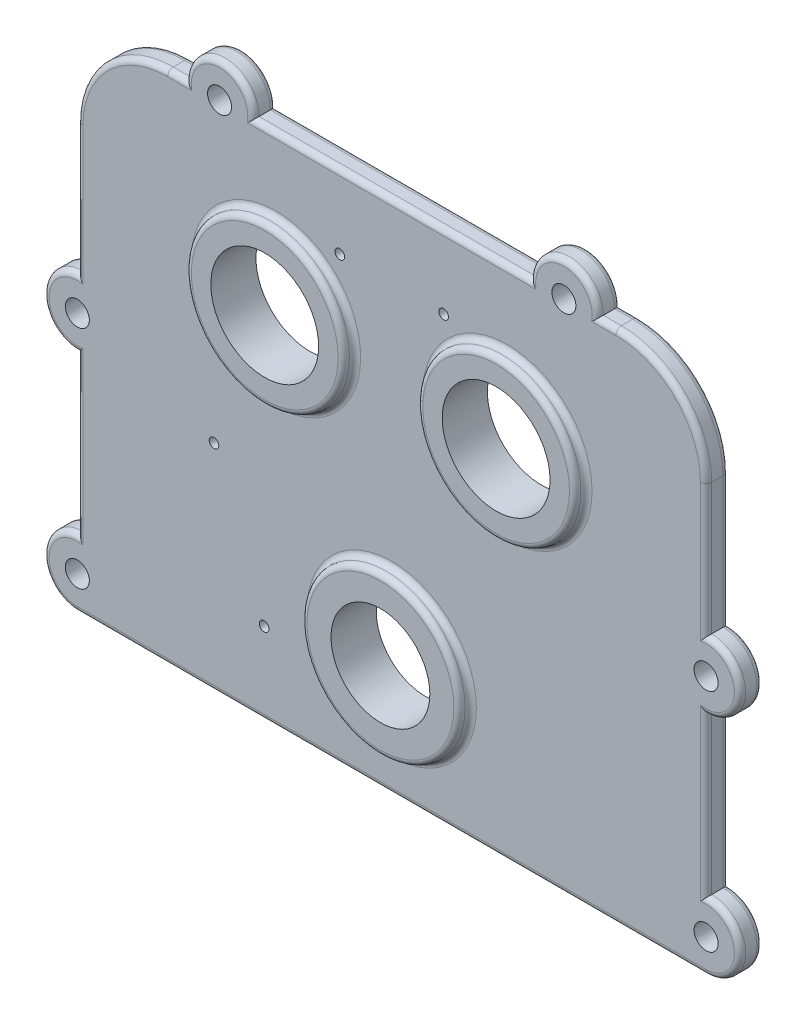
from build123d import *

# Parameters (mm, degrees)
BOSS_EXTRUDE1_DEPTH         = 6.35
FILLET1_R                   = 25.4
F_1_4_CLEARANCE_HOLE1_D     = 6.7564
F_1_4_CLEARANCE_HOLE1_DEPTH = 25.4
F_1_4_CLEARANCE_HOLE1_TIP   = 2.029827343
SKETCH4_R                   = 12.7
CUT_EXTRUDE1_DEPTH          = 146.024443286
BOSS_EXTRUDE2_DEPTH         = 3.175
BOSS_EXTRUDE2_DEPTH_BACK    = 9.525
SKETCH6_R                   = 22.225
SKETCH6_R_2                 = 12.7
FILLET2_R                   = 1.5875
FILLET3_R                   = 1.5875
SKETCH8_R                   = 15.1638
SKETCH8_R_2                 = 13.8938
CUT_EXTRUDE3_DEPTH          = 146.440904464
CUT_EXTRUDE4_DEPTH          = 1.905
CUT_EXTRUDE5_DEPTH          = 1.27
F_6_32_TAPPED_HOLE1_D       = 2.7051
SKETCH14_W                  = 176.85
SKETCH14_H                  = 51.885526621
CUT_EXTRUDE6_DEPTH          = 146.198114025
FILLET4_R                   = 1.5875
F_6_32_TAPPED_HOLE2_D       = 2.7051


with BuildPart() as part:
    # Sketch1 → Boss-Extrude1 (new body)
    with BuildSketch(Plane.XY):
        with BuildLine():
            Line((-88.425, 97.234375), (-57.94375, 97.234375))
            ThreePointArc((-57.94375, 97.234375), (-48.41875, 106.759375), (-38.89375, 97.234375))
            Line((-38.89375, 97.234375), (38.89375, 97.234375))
            ThreePointArc((38.89375, 97.234375), (48.41875, 106.759375), (57.94375, 97.234375))
            Line((57.94375, 97.234375), (88.425, 97.234375))
            Line((88.425, 97.234375), (88.425, 34.879852283))
            ThreePointArc((88.425, 34.879852283), (97.95, 25.354852283), (88.425, 15.829852283))
            Line((88.425, 15.829852283), (88.425, -28.620147717))
            ThreePointArc((88.425, -28.620147717), (97.95, -38.145147717), (88.425, -47.670147717))
            Line((88.425, -47.670147717), (88.425, -97.234375))
            Line((88.425, -97.234375), (-88.425, -97.234375))
            Line((-88.425, -97.234375), (-88.425, -47.670147717))
            ThreePointArc((-88.425, -47.670147717), (-97.95, -38.145147717), (-88.425, -28.620147717))
            Line((-88.425, -28.620147717), (-88.425, 15.829852283))
            ThreePointArc((-88.425, 15.829852283), (-97.95, 25.354852283), (-88.425, 34.879852283))
            Line((-88.425, 34.879852283), (-88.425, 97.234375))
        make_face()
    extrude(amount=BOSS_EXTRUDE1_DEPTH)

    # Fillet1
    fillet1_edges = [part.edges().sort_by_distance(p)[0] for p in [
        (88.425, -97.234375, 3.175),
        (-88.425, -97.234375, 3.175),
        (-88.425, 97.234375, 3.175),
        (88.425, 97.234375, 3.175),
    ]]
    fillet(fillet1_edges, radius=FILLET1_R)

    # 1/4 Clearance Hole1
    with Locations(Plane.XY.offset(6.35)):
        with Locations((-48.41875, 97.234375), (48.41875, 97.234375), (-88.425, 25.354852283), (-88.425, -38.145147717), (88.425, -38.145147717), (88.425, 25.354852283)):
            Hole(F_1_4_CLEARANCE_HOLE1_D / 2, depth=F_1_4_CLEARANCE_HOLE1_DEPTH)
            with Locations((0, 0, -(F_1_4_CLEARANCE_HOLE1_DEPTH + F_1_4_CLEARANCE_HOLE1_TIP / 2))):  # 118° drill point
                Cone(0, F_1_4_CLEARANCE_HOLE1_D / 2, F_1_4_CLEARANCE_HOLE1_TIP, mode=Mode.SUBTRACT)

    # Sketch4 → Cut-Extrude1 (cut, through all)
    with BuildSketch(Plane.XY.offset(6.35)):
        with Locations((0, -14.684375)):
            Circle(SKETCH4_R)
        with Locations((-32.54375, 54.371875)):
            Circle(SKETCH4_R)
        with Locations((32.54375, 54.371875)):
            Circle(SKETCH4_R)
    extrude(amount=-CUT_EXTRUDE1_DEPTH, mode=Mode.SUBTRACT)

    # Sketch6 → Boss-Extrude2 (add, two sides: drawn at the far end of the back side and taken through both)
    # profile 1 of 3: a face of its own
    with BuildSketch(Plane.XY.offset(6.35).offset(-BOSS_EXTRUDE2_DEPTH_BACK)):
        with Locations((-32.54375, 54.371875)):
            Circle(SKETCH6_R)
        with Locations((-32.54375, 54.371875)):
            Circle(SKETCH6_R_2, mode=Mode.SUBTRACT)
    # profile 2 of 3: a face of its own
    with BuildSketch(Plane.XY.offset(6.35).offset(-BOSS_EXTRUDE2_DEPTH_BACK)):
        with Locations((32.54375, 54.371875)):
            Circle(SKETCH6_R)
        with Locations((32.54375, 54.371875)):
            Circle(SKETCH6_R_2, mode=Mode.SUBTRACT)
    # profile 3 of 3: a face of its own
    with BuildSketch(Plane.XY.offset(6.35).offset(-BOSS_EXTRUDE2_DEPTH_BACK)):
        with Locations((0, -14.684375)):
            Circle(SKETCH6_R)
        with Locations((0, -14.684375)):
            Circle(SKETCH6_R_2, mode=Mode.SUBTRACT)
    extrude(amount=BOSS_EXTRUDE2_DEPTH + BOSS_EXTRUDE2_DEPTH_BACK)

    # Fillet2
    fillet2_edges = [part.edges().sort_by_distance(p)[0] for p in [
        (-54.76875, 54.371875, 6.35),
        (-54.76875, 54.371875, 0),
        (-54.76875, 54.371875, -3.175),
        (-54.76875, 54.371875, 9.525),
        (10.31875, 54.371875, 6.35),
        (10.31875, 54.371875, 0),
        (10.31875, 54.371875, -3.175),
        (10.31875, 54.371875, 9.525),
        (-22.225, -14.684375, 6.35),
        (-22.225, -14.684375, 0),
        (-22.225, -14.684375, -3.175),
        (-22.225, -14.684375, 9.525),
    ]]
    fillet(fillet2_edges, radius=FILLET2_R - 0.0001)  # a hair under: the kernel refuses the full size

    # Fillet3
    fillet3_edges = [part.edges().sort_by_distance(p)[0] for p in [
        (60.484375, 97.234375, 0),
        (80.985512242, 89.794887242, 0),
        (-60.484375, 97.234375, 0),
        (-80.985512242, 89.794887242, 0),
        (88.425, 53.357113641, 6.35),
        (60.484375, 97.234375, 6.35),
        (-60.484375, 97.234375, 6.35),
        (-88.425, 53.357113641, 6.35),
        (-48.41875, 106.759375, 0),
        (0, 97.234375, 0),
        (48.41875, 106.759375, 0),
        (88.425, 53.357113641, 0),
        (97.95, 25.354852283, 0),
        (88.425, -6.395147717, 0),
        (97.95, -38.145147717, 0),
        (-88.425, -6.395147717, 0),
        (-97.95, -38.145147717, 0),
        (-97.95, 25.354852283, 0),
        (-88.425, 53.357113641, 0),
        (-97.95, 25.354852283, 6.35),
        (-88.425, -6.395147717, 6.35),
        (-97.95, -38.145147717, 6.35),
        (97.95, -38.145147717, 6.35),
        (88.425, -6.395147717, 6.35),
        (97.95, 25.354852283, 6.35),
        (48.41875, 106.759375, 6.35),
        (80.985512242, 89.794887242, 6.35),
        (0, 97.234375, 6.35),
        (-48.41875, 106.759375, 6.35),
        (-80.985512242, 89.794887242, 6.35),
    ]]
    fillet(fillet3_edges, radius=FILLET3_R)

    # Sketch8 → Cut-Extrude3 (cut, through all)
    with BuildSketch(Plane.XY.offset(9.525)):
        with Locations((-32.54375, 54.371875)):
            Circle(SKETCH8_R)
        with Locations((32.54375, 54.371875)):
            Circle(SKETCH8_R)
        with Locations((0, -14.684375)):
            Circle(SKETCH8_R_2)
    extrude(amount=-CUT_EXTRUDE3_DEPTH, mode=Mode.SUBTRACT)

    # Sketch9 → Cut-Extrude4 (cut)
    with BuildSketch(Plane.XY.offset(6.5405)):
        with BuildLine():
            Line((47.388133501, 57.467857706), (44.217500828, 57.467857706))
            Line((44.217500828, 57.467857706), (44.217500828, 51.275892294))
            Line((44.217500828, 51.275892294), (47.388133501, 51.275892294))
            ThreePointArc((47.388133501, 51.275892294), (48.97755, 54.371875), (47.388133501, 57.467857706))
        make_face()
        with BuildLine():
            Line((-17.699366499, 57.467857706), (-20.869999172, 57.467857706))
            Line((-20.869999172, 57.467857706), (-20.869999172, 51.275892294))
            Line((-20.869999172, 51.275892294), (-17.699366499, 51.275892294))
            ThreePointArc((-17.699366499, 51.275892294), (-16.10995, 54.371875), (-17.699366499, 57.467857706))
        make_face()
    extrude(amount=CUT_EXTRUDE4_DEPTH, mode=Mode.SUBTRACT)

    # Sketch10 → Cut-Extrude5 (cut)
    with BuildSketch(Plane.XY.offset(5.207)):
        with BuildLine():
            Line((13.765971607, -12.804028184), (10.946910895, -12.804028184))
            Line((10.946910895, -12.804028184), (10.946910895, -16.564721816))
            Line((10.946910895, -16.564721816), (13.765971607, -16.564721816))
            ThreePointArc((13.765971607, -16.564721816), (14.6558, -14.684375), (13.765971607, -12.804028184))
        make_face()
    extrude(amount=CUT_EXTRUDE5_DEPTH, mode=Mode.SUBTRACT)

    # #6-32 Tapped Hole1 (through all)
    with Locations(Plane.XY.offset(6.35)):
        with Locations((-49.975216157, 12.94633769), (-35.877479348, -24.658898872)):
            Hole(F_6_32_TAPPED_HOLE1_D / 2)

    # Sketch14 → Cut-Extrude6 (cut, through all)
    with BuildSketch(Plane.XY.offset(6.35)):
        with Locations((0, -73.612911028)):
            Rectangle(SKETCH14_W, SKETCH14_H)
    extrude(amount=-CUT_EXTRUDE6_DEPTH, mode=Mode.SUBTRACT)

    # Fillet4
    fillet4_edges = [part.edges().sort_by_distance(p)[0] for p in [
        (0, -47.670147717, 0),
        (0, -47.670147717, 6.35),
    ]]
    fillet(fillet4_edges, radius=FILLET4_R)

    # #6-32 Tapped Hole2 (through all)
    with Locations(Plane(origin=(0, 0, 0), x_dir=(-1, 0, 0), z_dir=(0, 0, -1))):
        with Locations((-14.605, 76.622275), (14.605, 76.622275)):
            Hole(F_6_32_TAPPED_HOLE2_D / 2)


solid = part.part
